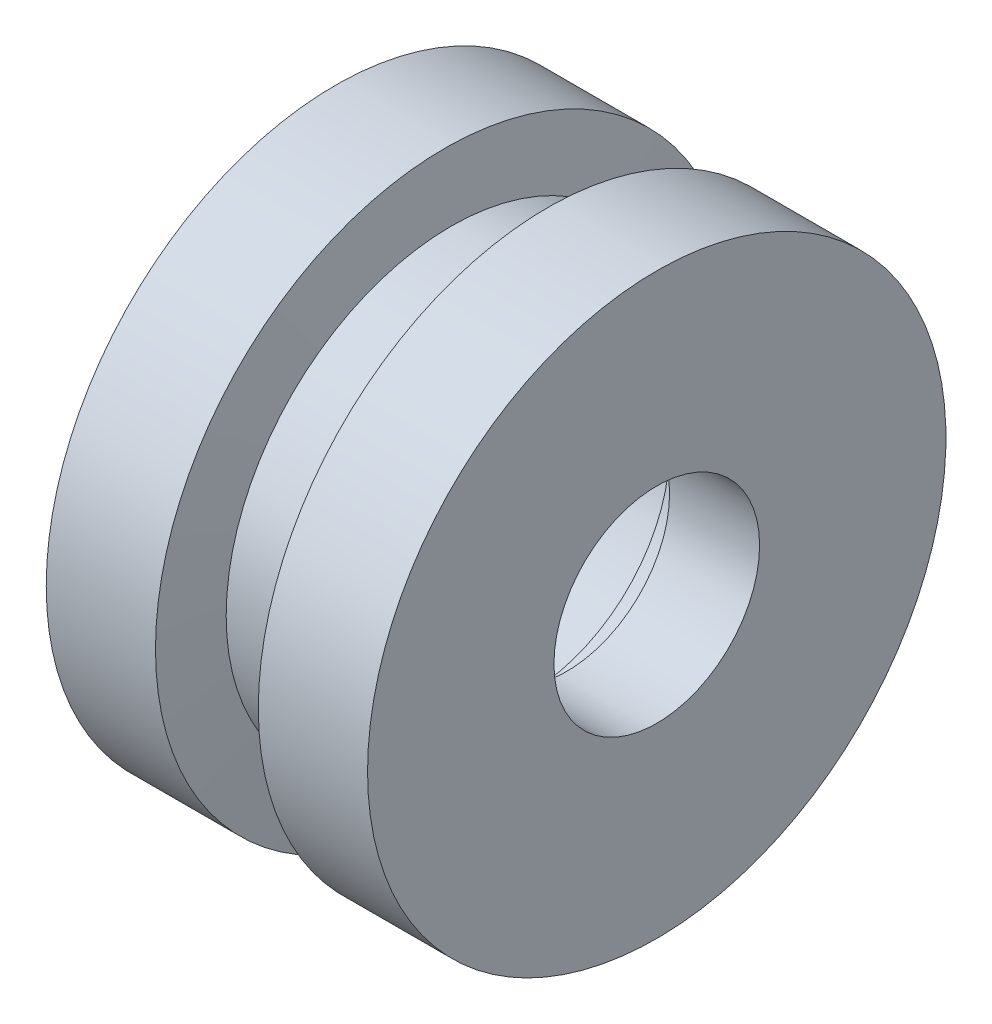
from build123d import *


with BuildPart() as part:
    # Sketch1 → Revolve1 (revolve)
    with BuildSketch(Plane(origin=(0, 0, 0), x_dir=(1, 0, 0), z_dir=(0, 1, 0))):
        Polygon((0, 22.5), (25, 22.5), (25, 12), (25, 11), (25, 8), (18, 8), (18, 11), (15, 11), (15, 12), (0, 12), align=None)
    revolve(axis=Axis((0, 0, 0), (1, 0, 0)))

    # Sketch4 → Cut-Revolve1 (revolve, cut)
    with BuildSketch(Plane(origin=(0, 0, 0), x_dir=(1, 0, 0), z_dir=(0, 1, 0))):
        Polygon((8.5, 22.5), (9, 17.5), (16, 17.5), (16.5, 22.5), align=None)
    revolve(axis=Axis((0, 0, 0), (1, 0, 0)), mode=Mode.SUBTRACT)


solid = part.part
